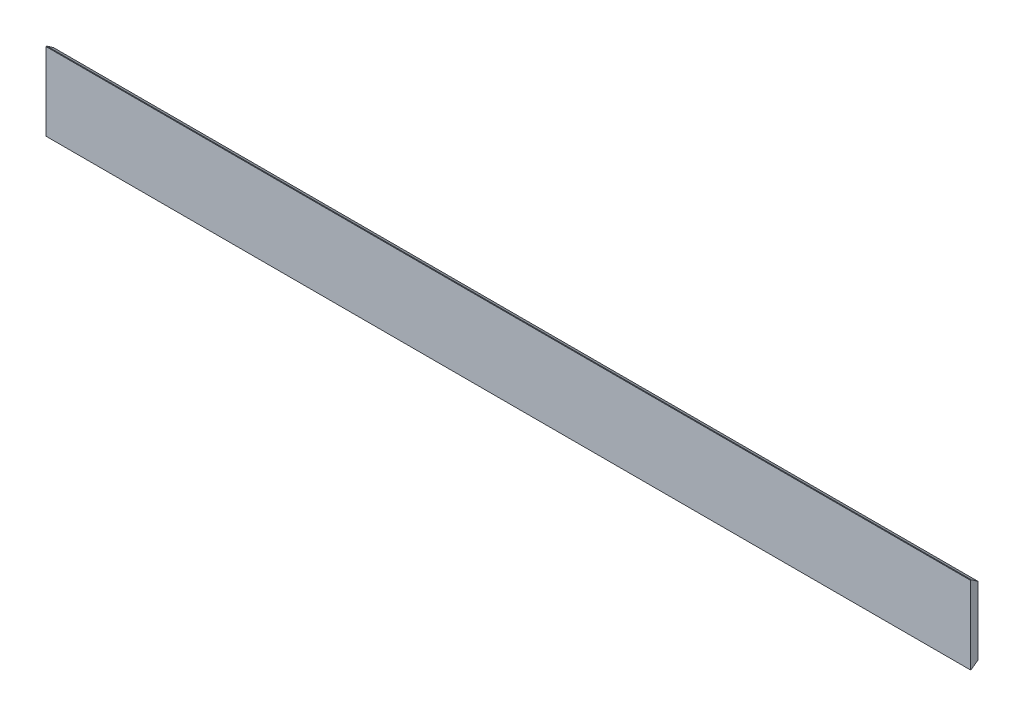
from build123d import *

# Parameters (mm, degrees)
SKETCH_1_W             = 2190
SKETCH_1_H             = 184
SM_BASE_FLANGE_1_DEPTH = 18
CUT_EXTRUDE_1_DEPTH    = 2193.005474446


# Sheet-metal steps are written as plain solids
with BuildPart() as part:
    # Sketch 1 → 基体-法兰1 (new body)
    with BuildSketch(Plane.XY):
        Rectangle(SKETCH_1_W, SKETCH_1_H)
    extrude(amount=-SM_BASE_FLANGE_1_DEPTH)

    # 草图6 → 切除-拉伸1 (cut, through all)
    with BuildSketch(Plane.ZY.offset(1095)):
        Polygon((-18, 92), (-18, 80.796679389), (-2, 92), align=None)
        Polygon((-18, -92), (-18, -80.796679389), (-2, -92), align=None)
    extrude(amount=-CUT_EXTRUDE_1_DEPTH, mode=Mode.SUBTRACT)


solid = part.part
